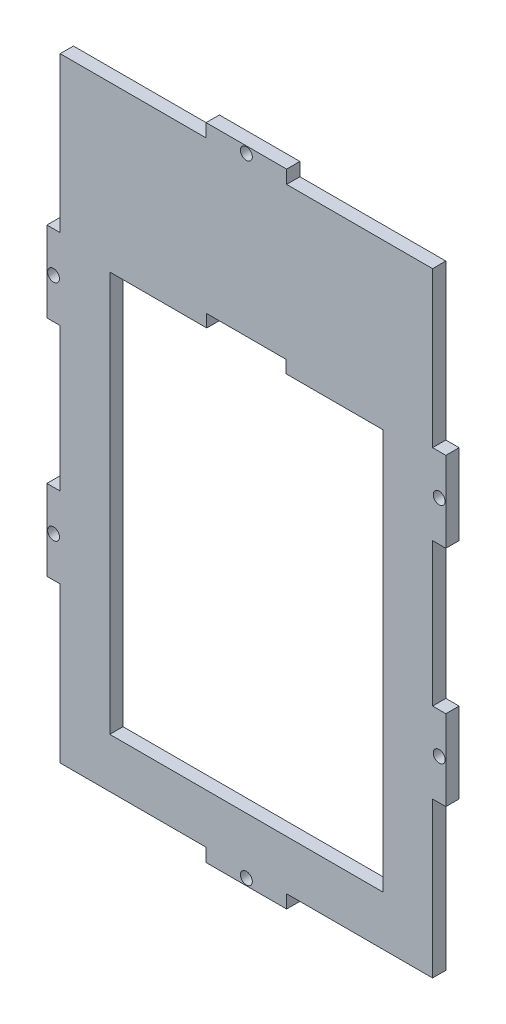
from build123d import *

# Parameters (mm, degrees)
BOSS_EXTRUDE1_DEPTH     = 3.18
CUT_EXTRUDE1_DEPTH      = 87.179315674
SKETCH27_W              = 3.18
SKETCH27_H              = 19.3
BOSS_EXTRUDE9_DEPTH     = 3.18
SKETCH28_W              = 19.3
SKETCH28_H              = 3.18
BOSS_EXTRUDE10_DEPTH    = 3.18
SKETCH29_R              = 1.425
CUT_EXTRUDE14_DEPTH     = 91.550668965
SKETCH30_R              = 1.425
CUT_EXTRUDE15_DEPTH     = 91.550668965
MIRROR9_COPY_1_SKETCH_W = 3.18
MIRROR9_COPY_1_SKETCH_H = 19.3
MIRROR9_COPY_1_DEPTH    = 3.18
MIRROR9_COPY_2_SKETCH_R = 1.425
MIRROR9_COPY_2_DEPTH    = 91.550668965
MIRROR9_COPY_3_SKETCH_W = 3.18
MIRROR9_COPY_3_SKETCH_H = 19.3
MIRROR9_COPY_3_DEPTH    = 3.18
MIRROR9_COPY_4_SKETCH_R = 1.425
MIRROR9_COPY_4_DEPTH    = 91.550668965


with BuildPart() as part:
    # Sketch1 → Boss-Extrude1 (new body)
    with BuildSketch(Plane.XY):
        Polygon((-44.645, 73.645), (-14.881666667, 73.645), (14.881666667, 73.645), (44.645, 73.645), (44.645, -73.645), (-44.645, -73.645), align=None)
    extrude(amount=BOSS_EXTRUDE1_DEPTH)

    # Sketch3 → Cut-Extrude1 (cut, through all)
    with BuildSketch(Plane(origin=(0, 0, 0), x_dir=(-1, 0, 0), z_dir=(0, 0, -1))):
        Polygon((-9.5, 34.25), (-32.75, 34.25), (-32.75, -61.75), (32.75, -61.75), (32.75, 34.25), (9.5, 34.25), (9.5, 37.25), (-9.5, 37.25), align=None)
    extrude(amount=-CUT_EXTRUDE1_DEPTH, mode=Mode.SUBTRACT)

    # Sketch27 → Boss-Extrude9 (add)
    with BuildSketch(Plane.ZY.offset(44.645)):
        with Locations((1.59, -26.825)):
            Rectangle(SKETCH27_W, SKETCH27_H)
    boss_extrude9 = extrude(amount=BOSS_EXTRUDE9_DEPTH)

    # Sketch28 → Boss-Extrude10 (add)
    with BuildSketch(Plane.XZ.offset(73.645)):
        with Locations((0, 1.59)):
            Rectangle(SKETCH28_W, SKETCH28_H)
    boss_extrude10 = extrude(amount=BOSS_EXTRUDE10_DEPTH)

    # Sketch29 → Cut-Extrude14 (cut, through all)
    with BuildSketch(Plane.XY.offset(3.18)):
        with Locations((-46.235, -26.825)):
            Circle(SKETCH29_R)
    cut_extrude14 = extrude(amount=-CUT_EXTRUDE14_DEPTH, mode=Mode.SUBTRACT)

    # Sketch30 → Cut-Extrude15 (cut, through all)
    with BuildSketch(Plane.XY.offset(3.18)):
        with Locations((0, -75.235)):
            Circle(SKETCH30_R)
    cut_extrude15 = extrude(amount=-CUT_EXTRUDE15_DEPTH, mode=Mode.SUBTRACT)

    # Mirror8: Boss-Extrude9, Cut-Extrude14 across plane
    add(boss_extrude9.mirror(Plane(origin=(0, 0, 0), x_dir=(0, 0, 1), z_dir=(1, 0, 0))))
    add(cut_extrude14.mirror(Plane(origin=(0, 0, 0), x_dir=(0, 0, 1), z_dir=(1, 0, 0))), mode=Mode.SUBTRACT)

    # Mirror9: Boss-Extrude10, Cut-Extrude15 across plane
    add(boss_extrude10.mirror(Plane.ZX))
    add(cut_extrude15.mirror(Plane.ZX), mode=Mode.SUBTRACT)

    # Mirror9 copy 1 sketch → Mirror9 copy 1 (add)
    with BuildSketch(Plane(origin=(44.645, 0, 0), x_dir=(0, 0, 1), z_dir=(1, 0, 0))):
        with Locations((1.59, -26.825)):
            Rectangle(MIRROR9_COPY_1_SKETCH_W, MIRROR9_COPY_1_SKETCH_H)
    extrude(amount=MIRROR9_COPY_1_DEPTH)

    # Mirror9 copy 2 sketch → Mirror9 copy 2 (cut, through all)
    with BuildSketch(Plane(origin=(0, 0, 3.18), x_dir=(-1, 0, 0), z_dir=(0, 0, 1))):
        with Locations((-46.235, -26.825)):
            Circle(MIRROR9_COPY_2_SKETCH_R)
    extrude(amount=-MIRROR9_COPY_2_DEPTH, mode=Mode.SUBTRACT)

    # Mirror9 copy 3 sketch → Mirror9 copy 3 (add)
    with BuildSketch(Plane.ZY.offset(44.645)):
        with Locations((1.59, 26.825)):
            Rectangle(MIRROR9_COPY_3_SKETCH_W, MIRROR9_COPY_3_SKETCH_H)
    extrude(amount=MIRROR9_COPY_3_DEPTH)

    # Mirror9 copy 4 sketch → Mirror9 copy 4 (cut, through all)
    with BuildSketch(Plane.XY.offset(3.18)):
        with Locations((-46.235, 26.825)):
            Circle(MIRROR9_COPY_4_SKETCH_R)
    extrude(amount=-MIRROR9_COPY_4_DEPTH, mode=Mode.SUBTRACT)


solid = part.part
